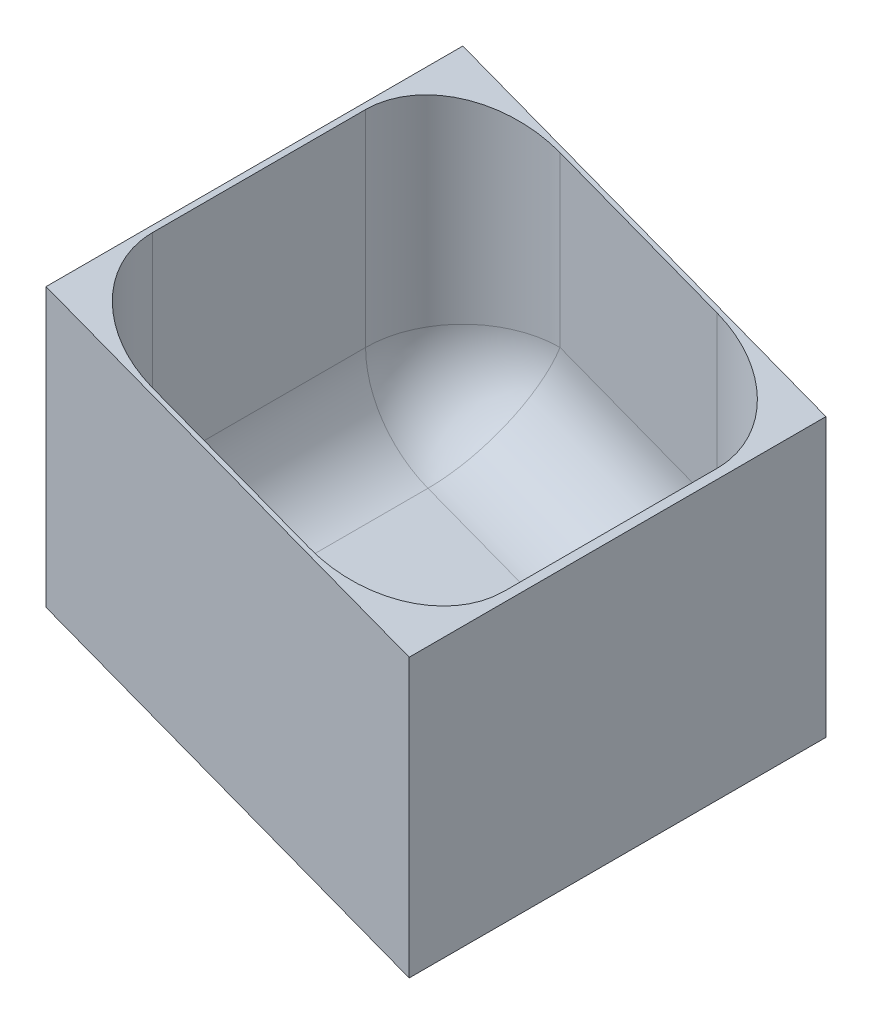
from build123d import *

# Parameters (mm, degrees)
BOSS_EXTRUDE1_DEPTH = 38.1
SHELL1_START        = -37.25333418
SHELL1_DEPTH        = 74.50666836
FILLET1_R           = 17.78


# Read off the part's stored shape, not the designer's step: Shell1
with BuildPart() as part:
    # Sketch1 → Boss-Extrude1 (new, symmetric)
    with BuildSketch(Plane.XY):
        Polygon((-33.198119966, 25.4), (-33.198119966, -25.4), (33.198119966, -50.887128572), (33.198119966, -0.087128572), align=None)
    extrude(amount=BOSS_EXTRUDE1_DEPTH, both=True)

    # Shell1 outline → Shell1 (cut)
    with BuildSketch(Plane.XY.offset(SHELL1_START)):
        Polygon((-32.351454146, 25.074995442), (-32.351454146, -24.818102704), (31.928119966, -49.492719393), (31.928119966, 0.400378753), align=None)
    extrude(amount=SHELL1_DEPTH, mode=Mode.SUBTRACT)

    # Fillet1
    fillet1_edges = [part.edges().sort_by_distance(p)[0] for p in [
        (-32.351454146, 0.128446369, -37.25333418),
        (-0.21166709, -37.155411048, -37.25333418),
        (-32.351454146, -24.818102704, 0),
        (31.928119966, -24.54617032, -37.25333418),
        (31.928119966, -49.492719393, 0),
        (-32.351454146, 0.128446369, 37.25333418),
        (-0.21166709, -37.155411048, 37.25333418),
        (31.928119966, -24.54617032, 37.25333418),
    ]]
    fillet(fillet1_edges, radius=FILLET1_R)


solid = part.part
